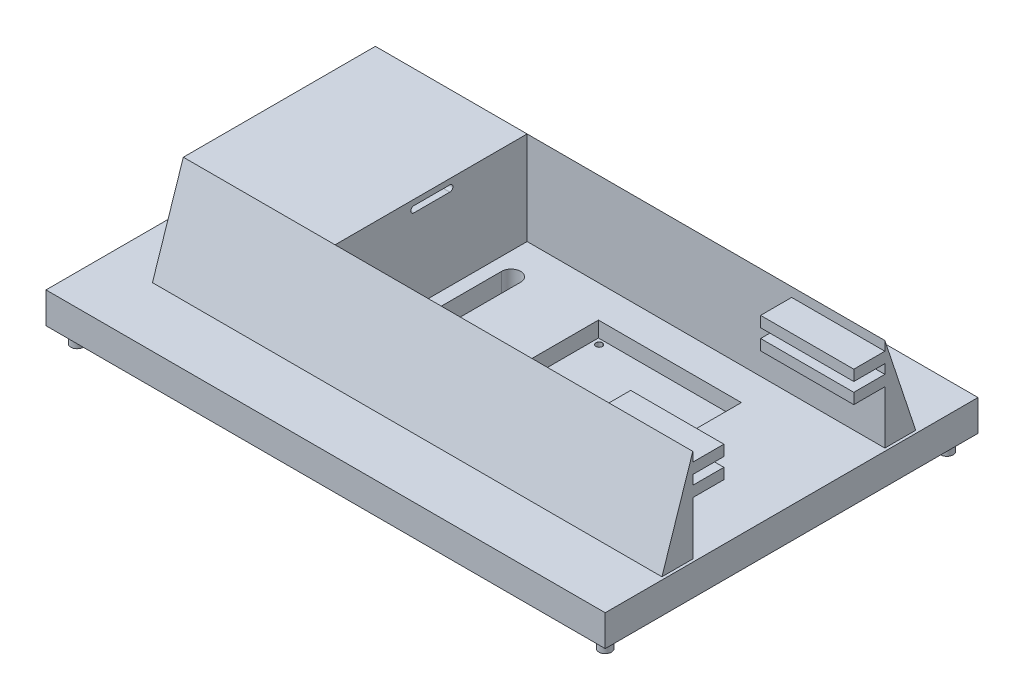
from build123d import *

# Parameters (mm, degrees)
SKETCH1_W                           = 180
SKETCH1_H                           = 120
BOSS_EXTRUDE1_DEPTH                 = 10
SKETCH2_W                           = 48.844317462
SKETCH2_H                           = 61.818589288
BOSS_EXTRUDE2_DEPTH                 = 30
SKETCH3_W                           = 27
SKETCH3_H                           = 27
CUT_EXTRUDE1_DEPTH                  = 10
CUT_EXTRUDE5_DEPTH                  = 171.851904114
TAP_DRILL_FOR_M2_5_TAP1_D           = 2.05
TAP_DRILL_FOR_M2_5_TAP1_DEPTH       = 5
TAP_DRILL_FOR_M2_5_TAP1_CSINK_D     = 2.1
TAP_DRILL_FOR_M2_5_TAP1_CSINK_ANGLE = 92
TAP_DRILL_FOR_M2_5_TAP1_TIP         = 0.615882135
CUT_EXTRUDE6_DEPTH                  = 113.249721603
BOSS_EXTRUDE3_DEPTH                 = 49
SKETCH14_W                          = 46
SKETCH14_H                          = 41
CUT_EXTRUDE8_DEPTH                  = 5
TAP_DRILL_FOR_M2_5_TAP2_D           = 2.05
TAP_DRILL_FOR_M2_5_TAP2_DEPTH       = 5
TAP_DRILL_FOR_M2_5_TAP2_CSINK_D     = 2.1
TAP_DRILL_FOR_M2_5_TAP2_CSINK_ANGLE = 92
TAP_DRILL_FOR_M2_5_TAP2_TIP         = 0.615882135
BOSS_EXTRUDE5_DEPTH                 = 115
BOSS_EXTRUDE6_DEPTH                 = 115
SKETCH25_R                          = 2
BOSS_EXTRUDE9_DEPTH                 = 5
SKETCH29_W                          = 30
SKETCH29_H                          = 3.45
BOSS_EXTRUDE10_DEPTH                = 10


with BuildPart() as part:
    # Sketch1 → Boss-Extrude1 (new body)
    with BuildSketch(Plane(origin=(0, 0, 0), x_dir=(1, 0, 0), z_dir=(0, 1, 0))):
        Rectangle(SKETCH1_W, SKETCH1_H)
    extrude(amount=BOSS_EXTRUDE1_DEPTH)

    # Sketch2 → Boss-Extrude2 (add)
    with BuildSketch(Plane(origin=(0, 10, 0), x_dir=(1, 0, 0), z_dir=(0, 1, 0))):
        with Locations((-50.466101441, 0)):
            Rectangle(SKETCH2_W, SKETCH2_H)
    extrude(amount=BOSS_EXTRUDE2_DEPTH)

    # Sketch3 → Cut-Extrude1 (cut)
    with BuildSketch(Plane.ZY.offset(74.888260172)):
        with Locations((0, 25)):
            Rectangle(SKETCH3_W, SKETCH3_H)
    extrude(amount=-CUT_EXTRUDE1_DEPTH, mode=Mode.SUBTRACT)

    # Sketch4 → Cut-Extrude5 (cut, through all)
    with BuildSketch(Plane.ZY.offset(64.888260172)):
        with BuildLine():
            Line((-6.024531525, 38.226394973), (5.549516036, 38.226394973))
            ThreePointArc((5.549516036, 38.226394973), (6.551598076, 37.224312933), (5.549516036, 36.222230893))
            Line((5.549516036, 36.222230893), (-6.024531525, 36.222230893))
            ThreePointArc((-6.024531525, 36.222230893), (-7.026613565, 37.224312933), (-6.024531525, 38.226394973))
        make_face()
    extrude(amount=-CUT_EXTRUDE5_DEPTH, mode=Mode.SUBTRACT)

    # Tap Drill for M2.5 Tap1
    with Locations(Plane(origin=(-64.888260172, 36.953397965, -12.070360422), x_dir=(0, 0, -1), z_dir=(-1, 0, 0))):
        with Locations((0, 0), (-24.059553717, -0.049505255), (-23.988973263, 23.863567836), (-0.227588633, 23.863567836)):
            CounterSinkHole(TAP_DRILL_FOR_M2_5_TAP1_D / 2, TAP_DRILL_FOR_M2_5_TAP1_CSINK_D / 2, depth=TAP_DRILL_FOR_M2_5_TAP1_DEPTH, counter_sink_angle=TAP_DRILL_FOR_M2_5_TAP1_CSINK_ANGLE)
            with Locations((0, 0, -(TAP_DRILL_FOR_M2_5_TAP1_DEPTH + TAP_DRILL_FOR_M2_5_TAP1_TIP / 2))):  # 118° drill point
                Cone(0, TAP_DRILL_FOR_M2_5_TAP1_D / 2, TAP_DRILL_FOR_M2_5_TAP1_TIP, mode=Mode.SUBTRACT)

    # Sketch9 → Cut-Extrude6 (cut, through all)
    with BuildSketch(Plane(origin=(0, 10, 0), x_dir=(1, 0, 0), z_dir=(0, 1, 0))):
        with BuildLine():
            Line((-21.846384178, -19.079811509), (-21.846384178, 18.507417164))
            ThreePointArc((-21.846384178, 18.507417164), (-18.793614336, 21.560187005), (-15.740844495, 18.507417164))
            Line((-15.740844495, 18.507417164), (-15.740844495, -19.079811509))
            ThreePointArc((-15.740844495, -19.079811509), (-18.793614336, -22.13258135), (-21.846384178, -19.079811509))
        make_face()
    extrude(amount=-CUT_EXTRUDE6_DEPTH, mode=Mode.SUBTRACT)

    # Sketch10 → Boss-Extrude3 (add)
    with BuildSketch(Plane.ZY.offset(74.888260172)):
        Polygon((30.909294644, 10), (30.909294644, 40), (40.847177304, 10), align=None)
    boss_extrude3 = extrude(amount=-BOSS_EXTRUDE3_DEPTH)

    # Mirror2: Boss-Extrude3 across plane
    add(boss_extrude3.mirror(Plane.XY))

    # Sketch14 → Cut-Extrude8 (cut)
    with BuildSketch(Plane(origin=(0, 10, 0), x_dir=(1, 0, 0), z_dir=(0, 1, 0))):
        with Locations((30.328073167, 0)):
            Rectangle(SKETCH14_W, SKETCH14_H)
    extrude(amount=-CUT_EXTRUDE8_DEPTH, mode=Mode.SUBTRACT)

    # Tap Drill for M2.5 Tap2
    with Locations(Plane(origin=(9.553554548, 5, 18.196456661), x_dir=(0, 0, 1), z_dir=(0, 1, 0))):
        with Locations((0, 0), (-36.962901754, -0.27584255), (-36.549137929, 41.997028299), (0.551685101, 41.997028299)):
            CounterSinkHole(TAP_DRILL_FOR_M2_5_TAP2_D / 2, TAP_DRILL_FOR_M2_5_TAP2_CSINK_D / 2, depth=TAP_DRILL_FOR_M2_5_TAP2_DEPTH, counter_sink_angle=TAP_DRILL_FOR_M2_5_TAP2_CSINK_ANGLE)
            with Locations((0, 0, -(TAP_DRILL_FOR_M2_5_TAP2_DEPTH + TAP_DRILL_FOR_M2_5_TAP2_TIP / 2))):  # 118° drill point
                Cone(0, TAP_DRILL_FOR_M2_5_TAP2_D / 2, TAP_DRILL_FOR_M2_5_TAP2_TIP, mode=Mode.SUBTRACT)

    # Sketch18 → Boss-Extrude5 (add)
    with BuildSketch(Plane(origin=(-25.888260172, 0, 0), x_dir=(0, 0, -1), z_dir=(1, 0, 0))):
        Polygon((40.847177304, 10), (30.909294644, 10), (30.909294644, 40), align=None)
    extrude(amount=BOSS_EXTRUDE5_DEPTH)

    # Sketch19 → Boss-Extrude6 (add)
    with BuildSketch(Plane(origin=(-25.888260172, 0, 0), x_dir=(0, 0, -1), z_dir=(1, 0, 0))):
        Polygon((-30.909294644, 10), (-40.847177304, 10), (-30.909294644, 40), align=None)
    extrude(amount=BOSS_EXTRUDE6_DEPTH)

    # Sketch25 → Boss-Extrude9 (add)
    with BuildSketch(Plane.XZ):
        with Locations((-85, -55)):
            Circle(SKETCH25_R)
        with Locations((-85, 55)):
            Circle(SKETCH25_R)
        with Locations((85, 55)):
            Circle(SKETCH25_R)
        with Locations((85, -55)):
            Circle(SKETCH25_R)
    extrude(amount=BOSS_EXTRUDE9_DEPTH)

    # Sketch29 → Boss-Extrude10 (add)
    with BuildSketch(Plane(origin=(0, 0, 30.909294644), x_dir=(-1, 0, 0), z_dir=(0, 0, -1))):
        with Locations((-74.111739828, 28.825)):
            Rectangle(SKETCH29_W, SKETCH29_H)
        with Locations((-74.111739828, 35.275)):
            Rectangle(SKETCH29_W, SKETCH29_H)
    boss_extrude10 = extrude(amount=BOSS_EXTRUDE10_DEPTH)

    # Mirror3: Boss-Extrude10 across plane
    add(boss_extrude10.mirror(Plane.XY))


solid = part.part
